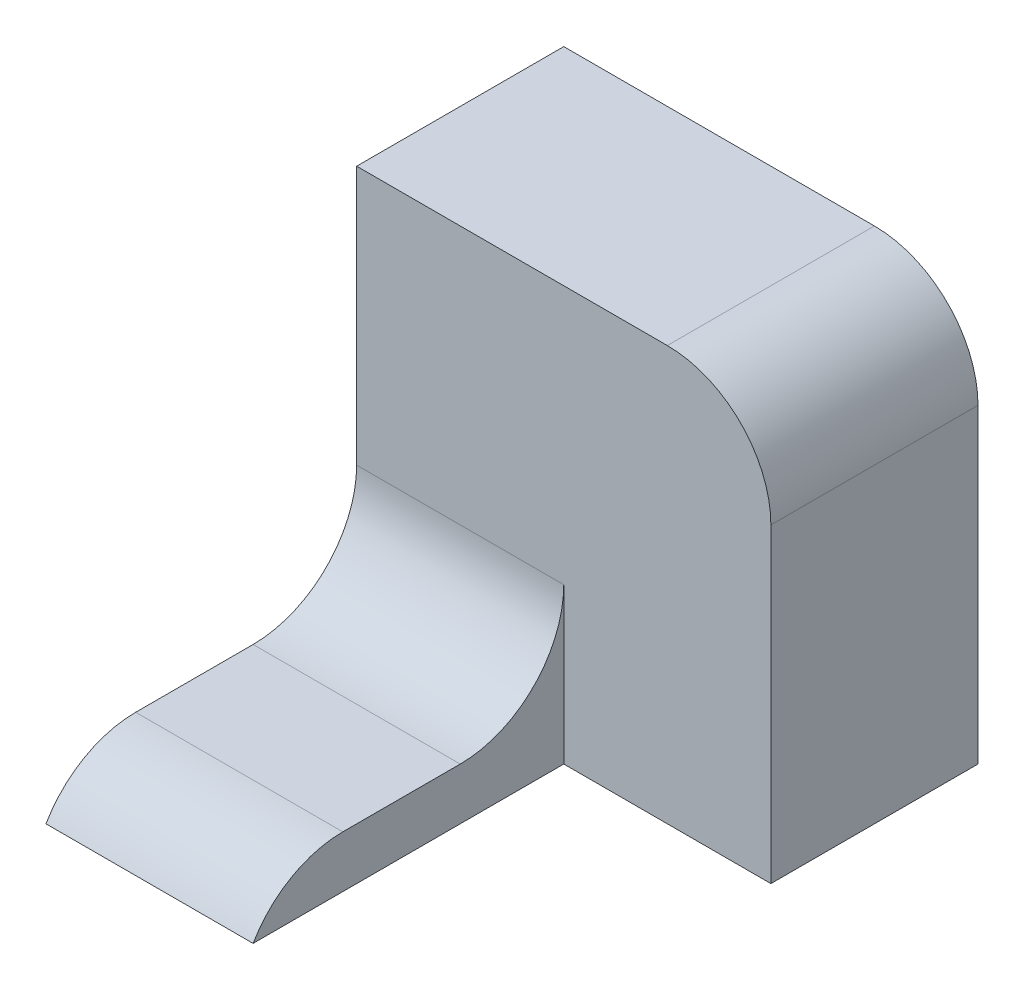
from build123d import *

# Parameters (mm, degrees)
SKETCH1_W           = 20
SKETCH1_H           = 5
BOSS_EXTRUDE1_DEPTH = 30
SKETCH2_W           = 40
SKETCH2_H           = 40
BOSS_EXTRUDE2_DEPTH = 20
FILLET1_R           = 10


with BuildPart() as part:
    # Sketch1 → Boss-Extrude1 (new body)
    with BuildSketch(Plane.XY):
        with Locations((-20, -2.5)):
            Rectangle(SKETCH1_W, SKETCH1_H)
    extrude(amount=BOSS_EXTRUDE1_DEPTH)

    # Sketch2 → Boss-Extrude2 (add)
    with BuildSketch(Plane.XY):
        with Locations((-10, 15)):
            Rectangle(SKETCH2_W, SKETCH2_H)
    extrude(amount=-BOSS_EXTRUDE2_DEPTH)

    # Fillet1
    # the kernel refuses this fillet: 10 mm, written as the material it adds along each edge
    with BuildSketch(Plane(origin=(-10, 0, 0), x_dir=(0, 1, 0), z_dir=(-1, 0, 0))) as fillet1_piece_1:
        with BuildLine():
            CenterArc((FILLET1_R, -FILLET1_R), FILLET1_R, 90, 90)
            Line((0, -FILLET1_R), (0, 0))
            Line((0, 0), (FILLET1_R, 0))
        make_face()
    extrude(amount=20)
    # the kernel refuses this fillet: 10 mm, written as the material it takes off along each edge
    with BuildSketch(Plane(origin=(10, 35, 25), x_dir=(-1, 0, 0), z_dir=(0, 0, -1))) as fillet1_2_piece_1:
        with BuildLine():
            CenterArc((FILLET1_R, -FILLET1_R), FILLET1_R, 90, 90)
            Line((0, -FILLET1_R), (0, 0))
            Line((0, 0), (FILLET1_R, 0))
        make_face()
    extrude(amount=70, mode=Mode.SUBTRACT)
    with BuildSketch(Plane(origin=(11.650635095, 0, 30), x_dir=(0, 0, -1), z_dir=(-1, 0, 0))) as fillet1_2_piece_2:
        with BuildLine():
            CenterArc((8.660254038, 10), FILLET1_R, 210, 60)
            Line((0, 5), (0, 0))
            Line((0, 0), (8.660254038, 0))
        make_face()
    extrude(amount=63.301270189, mode=Mode.SUBTRACT)


solid = part.part
